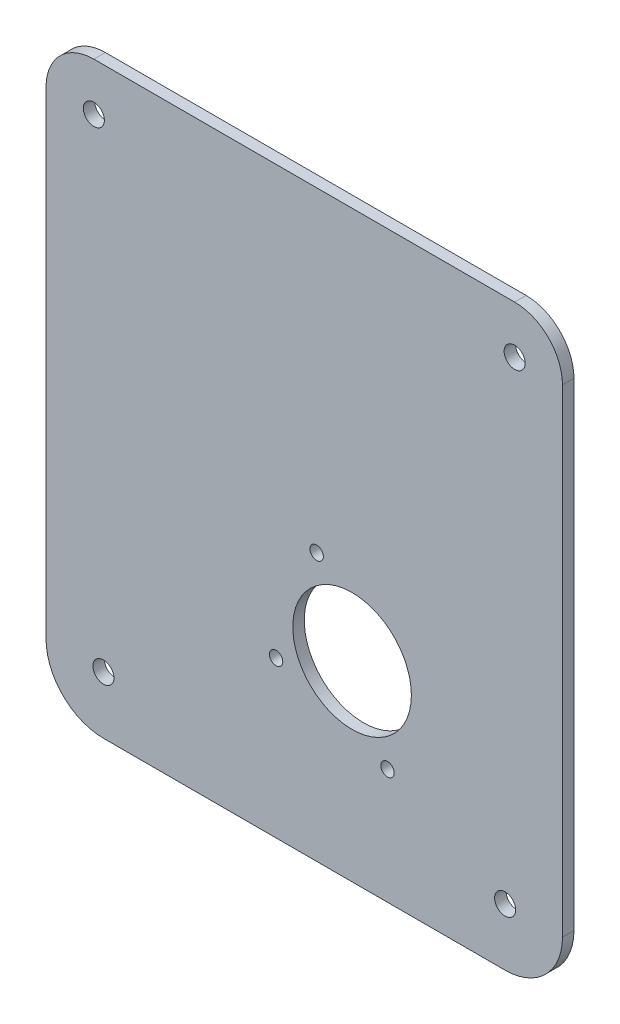
from build123d import *

# Parameters (mm, degrees)
BASE_FLANGE1_DEPTH   = 3
SKETCH2_R            = 15.5
SKETCH2_R_2          = 1.75
CUT_EXTRUDE1_DEPTH   = 131.05864062
M5_CLEARANCE_HOLE1_D = 5.5


# Sheet-metal steps are written as plain solids
with BuildPart() as part:
    # Sketch1 → Base-Flange1 (new body)
    with BuildSketch(Plane.XY):
        with BuildLine():
            Line((-67.5, 102.5), (42.5, 102.5))
            ThreePointArc((42.5, 102.5), (51.338834765, 98.838834765), (55, 90))
            Line((55, 90), (55, -35))
            ThreePointArc((55, -35), (50.606601718, -45.606601718), (40, -50))
            Line((40, -50), (-65, -50))
            ThreePointArc((-65, -50), (-75.606601718, -45.606601718), (-80, -35))
            Line((-80, -35), (-80, 90))
            ThreePointArc((-80, 90), (-76.338834765, 98.838834765), (-67.5, 102.5))
        make_face()
    extrude(amount=BASE_FLANGE1_DEPTH)

    # Sketch2 → Cut-Extrude1 (cut, through all)
    with BuildSketch(Plane.XY.offset(3)):
        Circle(SKETCH2_R)
        with Locations((-19.866547844, -9.263923401)):
            Circle(SKETCH2_R_2)
        with Locations((9.263923401, -19.866547844)):
            Circle(SKETCH2_R_2)
        with Locations((-9.263923401, 19.866547844)):
            Circle(SKETCH2_R_2)
    extrude(amount=-CUT_EXTRUDE1_DEPTH, mode=Mode.SUBTRACT)

    # M5 Clearance Hole1 (through all)
    with Locations(Plane(origin=(0, 0, 0), x_dir=(-1, 0, 0), z_dir=(0, 0, -1))):
        with Locations((-40, -35), (67.5, 90), (65, -35), (-42.5, 90)):
            Hole(M5_CLEARANCE_HOLE1_D / 2)


solid = part.part
